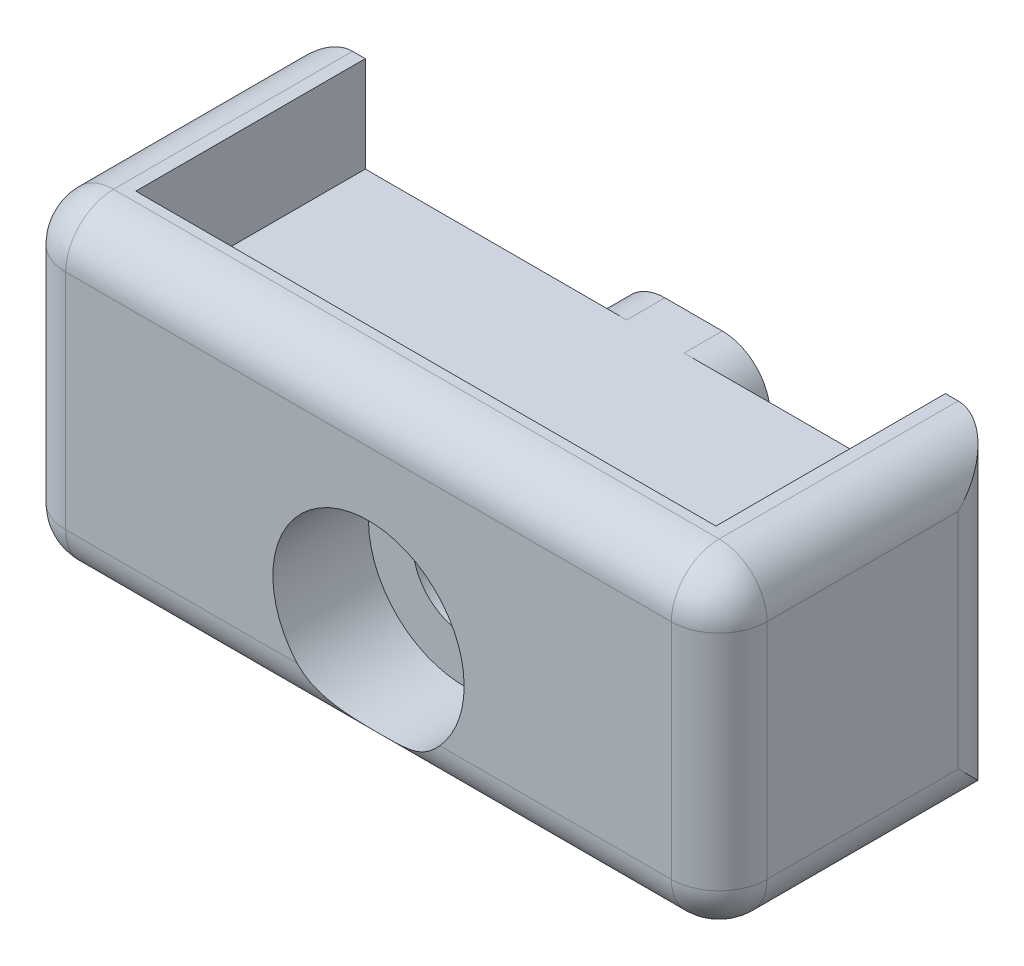
from build123d import *

# Parameters (mm, degrees)
BOSS_EXTRU_1_DEPTH      = 10
ESQUISSE2_W             = 18.2
ESQUISSE2_H             = 8.4
ENL_V_MAT_EXTRU_1_DEPTH = 3
ESQUISSE3_R             = 1.6
ENL_V_MAT_EXTRU_2_DEPTH = 19.028865744
ESQUISSE4_R             = 3
ENL_V_MAT_EXTRU_3_DEPTH = 3
CONG_1_R                = 1.5


with BuildPart() as part:
    # Esquisse1 → Boss.-Extru.1 (new body)
    with BuildSketch(Plane(origin=(0, 0, 0), x_dir=(1, 0, 0), z_dir=(0, 1, 0))):
        Polygon((2.4, 0), (11, 0), (11, -9), (-11, -9), (-11, 0), (-2.4, 0), (-2.4, 1.2), (2.4, 1.2), align=None)
    extrude(amount=BOSS_EXTRU_1_DEPTH)

    # Esquisse2 → Enlèv. mat.-Extru.1 (cut)
    with BuildSketch(Plane(origin=(0, 10, 0), x_dir=(1, 0, 0), z_dir=(0, 1, 0))):
        with Locations((0, -3)):
            Rectangle(ESQUISSE2_W, ESQUISSE2_H)
    extrude(amount=-ENL_V_MAT_EXTRU_1_DEPTH, mode=Mode.SUBTRACT)

    # Esquisse3 → Enlèv. mat.-Extru.2 (cut, through all)
    with BuildSketch(Plane(origin=(0, 0, -1.2), x_dir=(-1, 0, 0), z_dir=(0, 0, -1))):
        with Locations((0, 3.5)):
            Circle(ESQUISSE3_R)
    extrude(amount=-ENL_V_MAT_EXTRU_2_DEPTH, mode=Mode.SUBTRACT)

    # Esquisse4 → Enlèv. mat.-Extru.3 (cut)
    with BuildSketch(Plane.XY.offset(9)):
        with Locations((0, 3.5)):
            Circle(ESQUISSE4_R)
    extrude(amount=-ENL_V_MAT_EXTRU_3_DEPTH, mode=Mode.SUBTRACT)

    # Congé1
    # the kernel refuses this fillet: 1.5 mm, written as the material it takes off along each edge
    with BuildSketch(Plane(origin=(9.5, 8.5, 7.5), x_dir=(0, 1, 0), z_dir=(1, 0, 0))) as cong_1_piece_1_section:
        Polygon((0, 0), (CONG_1_R, 0), (CONG_1_R, CONG_1_R), (0, CONG_1_R), align=None)
    cong_1_piece_1 = extrude(amount=CONG_1_R, mode=Mode.PRIVATE)
    cong_1_piece_1 = cong_1_piece_1 - Plane(origin=(9.5, 8.5, 7.5), x_dir=(0, -0.7071067811865475, -0.7071067811865475), z_dir=(1, 0, 0)) * Sphere(CONG_1_R, mode=Mode.PRIVATE)
    add(cong_1_piece_1, mode=Mode.SUBTRACT)
    with BuildSketch(Plane(origin=(9.5, 1.5, 7.5), x_dir=(1, 0, 0), z_dir=(0, -1, 0))) as cong_1_piece_2_section:
        Polygon((0, 0), (CONG_1_R, 0), (CONG_1_R, CONG_1_R), (0, CONG_1_R), align=None)
    cong_1_piece_2 = extrude(amount=CONG_1_R, mode=Mode.PRIVATE)
    cong_1_piece_2 = cong_1_piece_2 - Plane(origin=(9.5, 1.5, 7.5), x_dir=(-0.7071067811865476, 0, -0.7071067811865475), z_dir=(0, -1, 0)) * Sphere(CONG_1_R, mode=Mode.PRIVATE)
    add(cong_1_piece_2, mode=Mode.SUBTRACT)
    with BuildSketch(Plane(origin=(-9.5, 1.5, 7.5), x_dir=(0, -1, 0), z_dir=(-1, 0, 0))) as cong_1_piece_3_section:
        Polygon((0, 0), (CONG_1_R, 0), (CONG_1_R, CONG_1_R), (0, CONG_1_R), align=None)
    cong_1_piece_3 = extrude(amount=CONG_1_R, mode=Mode.PRIVATE)
    cong_1_piece_3 = cong_1_piece_3 - Plane(origin=(-9.5, 1.5, 7.5), x_dir=(0, 0.7071067811865475, -0.7071067811865475), z_dir=(-1, 0, 0)) * Sphere(CONG_1_R, mode=Mode.PRIVATE)
    add(cong_1_piece_3, mode=Mode.SUBTRACT)
    with BuildSketch(Plane(origin=(-9.5, 8.5, 7.5), x_dir=(0, 1, 0), z_dir=(-1, 0, 0))) as cong_1_piece_4_section:
        Polygon((0, 0), (CONG_1_R, 0), (CONG_1_R, -CONG_1_R), (0, -CONG_1_R), align=None)
    cong_1_piece_4 = extrude(amount=CONG_1_R, mode=Mode.PRIVATE)
    cong_1_piece_4 = cong_1_piece_4 - Plane(origin=(-9.5, 8.5, 7.5), x_dir=(0, -0.7071067811865475, -0.7071067811865475), z_dir=(-1, 0, 0)) * Sphere(CONG_1_R, mode=Mode.PRIVATE)
    add(cong_1_piece_4, mode=Mode.SUBTRACT)
    with BuildSketch(Plane(origin=(11, 10, -3.75), x_dir=(0, -1, 0), z_dir=(0, 0, 1)), Plane(origin=(-11, 0, 7.5), x_dir=(1, 0, 0), z_dir=(0, 0, -1)), Plane(origin=(11, 0, -3.75), x_dir=(-1, 0, 0), z_dir=(0, 0, 1))) as cong_1_piece_5:
        with BuildLine():
            CenterArc((CONG_1_R, -CONG_1_R), CONG_1_R, 90, 90)
            Line((0, -CONG_1_R), (0, 0))
            Line((0, 0), (CONG_1_R, 0))
        make_face()
    extrude(amount=11.25, mode=Mode.SUBTRACT)
    with BuildSketch(Plane(origin=(9.5, 0, 9), x_dir=(0, 0, -1), z_dir=(-1, 0, 0))) as cong_1_piece_6:
        with BuildLine():
            CenterArc((CONG_1_R, -CONG_1_R), CONG_1_R, 90, 90)
            Line((0, -CONG_1_R), (0, 0))
            Line((0, 0), (CONG_1_R, 0))
        make_face()
    extrude(amount=19, mode=Mode.SUBTRACT)
    with BuildSketch(Plane(origin=(-11, -3.75, 0), x_dir=(0, 0, 1), z_dir=(0, 1, 0)), Plane(origin=(11, -3.75, 0), x_dir=(-1, 0, 0), z_dir=(0, 1, 0))) as cong_1_piece_7:
        with BuildLine():
            CenterArc((CONG_1_R, CONG_1_R), CONG_1_R, 180, 90)
            Line((0, CONG_1_R), (0, 0))
            Line((0, 0), (CONG_1_R, 0))
        make_face()
    extrude(amount=17.5, mode=Mode.SUBTRACT)
    with BuildSketch(Plane(origin=(11, 1.5, 9), x_dir=(0, 0, -1), z_dir=(0, 1, 0)), Plane(origin=(-11, 1.5, 9), x_dir=(1, 0, 0), z_dir=(0, 1, 0))) as cong_1_piece_8:
        with BuildLine():
            CenterArc((CONG_1_R, CONG_1_R), CONG_1_R, 180, 90)
            Line((0, CONG_1_R), (0, 0))
            Line((0, 0), (CONG_1_R, 0))
        make_face()
    extrude(amount=7, mode=Mode.SUBTRACT)
    with BuildSketch(Plane(origin=(2.4, 7, 0), x_dir=(-1, 0, 0), z_dir=(0, 0, -1)), Plane(origin=(-2.4, 7, -4.95), x_dir=(1, 0, 0), z_dir=(0, 0, 1)), Plane(origin=(-2.4, 0, 0), x_dir=(1, 0, 0), z_dir=(0, 0, -1)), Plane(origin=(2.4, 0, -4.95), x_dir=(-1, 0, 0), z_dir=(0, 0, 1))) as cong_1_piece_9:
        with BuildLine():
            CenterArc((CONG_1_R, -CONG_1_R), CONG_1_R, 90, 90)
            Line((0, -CONG_1_R), (0, 0))
            Line((0, 0), (CONG_1_R, 0))
        make_face()
    extrude(amount=4.95, mode=Mode.SUBTRACT)
    with BuildSketch(Plane(origin=(-11, 10, 7.5), x_dir=(1, 0, 0), z_dir=(0, 0, -1))) as cong_1_piece_10:
        with BuildLine():
            CenterArc((CONG_1_R, CONG_1_R), CONG_1_R, 180, 90)
            Line((0, CONG_1_R), (0, 0))
            Line((0, 0), (CONG_1_R, 0))
        make_face()
    extrude(amount=11.25, mode=Mode.SUBTRACT)
    with BuildSketch(Plane(origin=(9.5, 10, 9), x_dir=(0, 0, -1), z_dir=(-1, 0, 0))) as cong_1_piece_11:
        with BuildLine():
            CenterArc((CONG_1_R, CONG_1_R), CONG_1_R, 180, 90)
            Line((0, CONG_1_R), (0, 0))
            Line((0, 0), (CONG_1_R, 0))
        make_face()
    extrude(amount=19, mode=Mode.SUBTRACT)


solid = part.part
